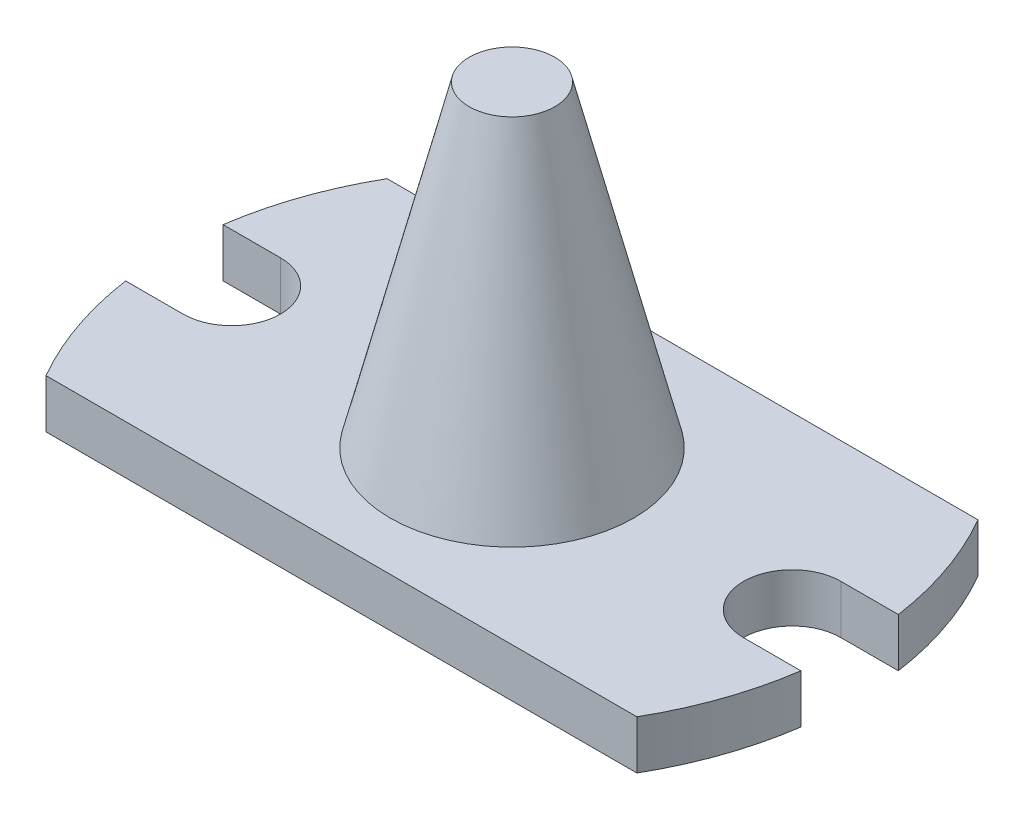
from build123d import *

# Parameters (mm, degrees)
BOSS_EXTRUDE1_DEPTH = 10


with BuildPart() as part:
    # Sketch1 → Boss-Extrude1 (new body)
    with BuildSketch(Plane(origin=(0, 0, 0), x_dir=(1, 0, 0), z_dir=(0, 1, 0))):
        with BuildLine():
            Line((-48.377521141, 60.743040112), (66.622478859, 60.743040112))
            Line((66.622478859, 60.743040112), (69.744257124, 60.743040112))
            ThreePointArc((69.744257124, 60.743040112), (75.266261636, 48.655918587), (78.404511162, 35.743040112))
            Line((78.404511162, 35.743040112), (66.622478859, 35.743040112))
            ThreePointArc((66.622478859, 35.743040112), (56.622478859, 25.743040112), (66.622478859, 15.743040112))
            Line((66.622478859, 15.743040112), (78.404511162, 15.743040112))
            ThreePointArc((78.404511162, 15.743040112), (75.266261636, 2.830161637), (69.744257124, -9.256959888))
            Line((69.744257124, -9.256959888), (66.622478859, -9.256959888))
            Line((66.622478859, -9.256959888), (-48.377521141, -9.256959888))
            Line((-48.377521141, -9.256959888), (-51.499299406, -9.256959888))
            ThreePointArc((-51.499299406, -9.256959888), (-57.021303917, 2.830161637), (-60.159553444, 15.743040112))
            Line((-60.159553444, 15.743040112), (-48.377521141, 15.743040112))
            ThreePointArc((-48.377521141, 15.743040112), (-38.377521141, 25.743040112), (-48.377521141, 35.743040112))
            Line((-48.377521141, 35.743040112), (-60.159553444, 35.743040112))
            ThreePointArc((-60.159553444, 35.743040112), (-57.021303917, 48.655918587), (-51.499299406, 60.743040112))
            Line((-51.499299406, 60.743040112), (-48.377521141, 60.743040112))
        make_face()
    extrude(amount=BOSS_EXTRUDE1_DEPTH)

    # Sketch2 → Revolve1 (revolve)
    with BuildSketch(Plane.ZY.offset(-9.122478859)):
        Polygon((-25.743040112, 75), (-25.743040112, 10), (-50.743040112, 10), (-34.536719927, 75), align=None)
    revolve(axis=Axis((9.122478859, 75, -25.743040112), (0, -1, 0)))


solid = part.part
